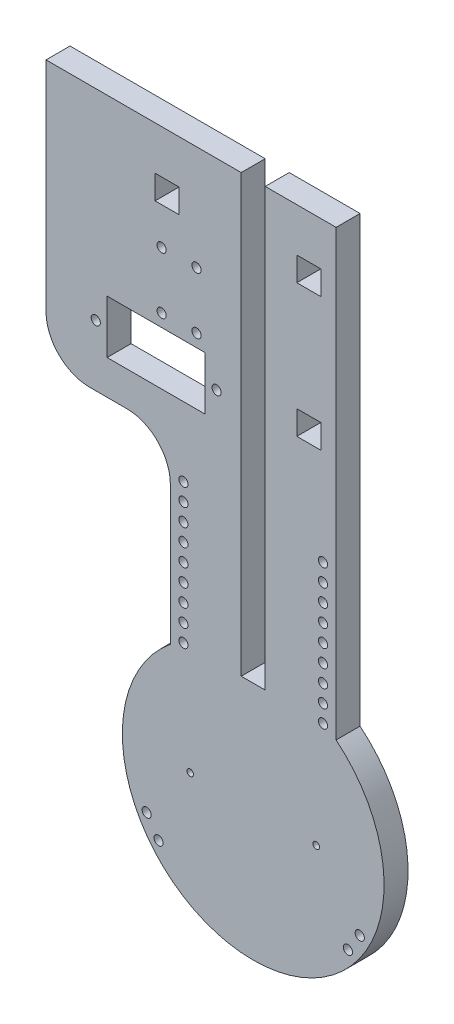
from build123d import *

# Parameters (mm, degrees)
EXTRUDE_1_DEPTH      = 5.5
SKETCH_5_R           = 0.75
CUT_EXTRUDE_3_DEPTH  = 134.83385222
SKETCH_6_R           = 1.05
CUT_EXTRUDE_4_DEPTH  = 134.83385222
SKETCH_8_W           = 5.5
SKETCH_8_H           = 5.5
CUT_EXTRUDE_6_DEPTH  = 134.83385222
SKETCH_9_R           = 1.05
CUT_EXTRUDE_7_DEPTH  = 134.83385222
SKETCH_10_W          = 5.5
SKETCH_10_H          = 100
CUT_EXTRUDE_8_DEPTH  = 134.83385222
SKETCH_11_R          = 1.05
CUT_EXTRUDE_9_DEPTH  = 134.83385222
SKETCH_12_R          = 1.05
SKETCH_12_W          = 22.5
SKETCH_12_H          = 12.2
CUT_EXTRUDE_10_DEPTH = 10
FILLET_1_R           = 10


with BuildPart() as part:
    # ｽｹｯﾁ1 → ﾎﾞｽ - 押し出し1 (new body)
    with BuildSketch(Plane.XY):
        with BuildLine():
            Line((19, 125), (-47.5, 125))
            Line((-47.5, 125), (-47.5, 65))
            Line((-47.5, 65), (-19, 65))
            Line((-19, 65), (-19, 23.216373532))
            ThreePointArc((-19, 23.216373532), (0, -30), (19, 23.216373532))
            Line((19, 23.216373532), (19, 125))
        make_face()
    extrude(amount=EXTRUDE_1_DEPTH)

    # ｽｹｯﾁ5 → ｶｯﾄ - 押し出し3 (cut, through all)
    with BuildSketch(Plane.XY.offset(5.5)):
        with Locations((14.45, 0)):
            Circle(SKETCH_5_R)
        with Locations((-14.45, 0)):
            Circle(SKETCH_5_R)
    extrude(amount=-CUT_EXTRUDE_3_DEPTH, mode=Mode.SUBTRACT)

    # ｽｹｯﾁ6 → ｶｯﾄ - 押し出し4 (cut, through all)
    with BuildSketch(Plane.XY.offset(5.5)):
        with Locations((-24.425038206, -12.880897043)):
            Circle(SKETCH_6_R)
        with Locations((-21.701843031, -17.074249883)):
            Circle(SKETCH_6_R)
        with Locations((24.425038206, -12.880897043)):
            Circle(SKETCH_6_R)
        with Locations((21.701843031, -17.074249883)):
            Circle(SKETCH_6_R)
    extrude(amount=-CUT_EXTRUDE_4_DEPTH, mode=Mode.SUBTRACT)

    # ｽｹｯﾁ8 → ｶｯﾄ - 押し出し6 (cut, through all)
    with BuildSketch(Plane.XY.offset(5.5)):
        with Locations((12.75, 112.25)):
            Rectangle(SKETCH_8_W, SKETCH_8_H)
        with Locations((-19.75, 112.25)):
            Rectangle(SKETCH_8_W, SKETCH_8_H)
        with Locations((12.75, 81.75)):
            Rectangle(SKETCH_8_W, SKETCH_8_H)
    extrude(amount=-CUT_EXTRUDE_6_DEPTH, mode=Mode.SUBTRACT)

    # ｽｹｯﾁ9 → ｶｯﾄ - 押し出し7 (cut, through all)
    with BuildSketch(Plane.XY.offset(5.5)):
        with Locations((16, 25)):
            Circle(SKETCH_9_R)
        with Locations((16, 29)):
            Circle(SKETCH_9_R)
        with Locations((16, 33)):
            Circle(SKETCH_9_R)
        with Locations((16, 37)):
            Circle(SKETCH_9_R)
        with Locations((16, 41)):
            Circle(SKETCH_9_R)
        with Locations((16, 45)):
            Circle(SKETCH_9_R)
        with Locations((16, 49)):
            Circle(SKETCH_9_R)
        with Locations((16, 53)):
            Circle(SKETCH_9_R)
        with Locations((16, 57)):
            Circle(SKETCH_9_R)
        with Locations((-16, 57)):
            Circle(SKETCH_9_R)
        with Locations((-16, 53)):
            Circle(SKETCH_9_R)
        with Locations((-16, 49)):
            Circle(SKETCH_9_R)
        with Locations((-16, 45)):
            Circle(SKETCH_9_R)
        with Locations((-16, 41)):
            Circle(SKETCH_9_R)
        with Locations((-16, 37)):
            Circle(SKETCH_9_R)
        with Locations((-16, 33)):
            Circle(SKETCH_9_R)
        with Locations((-16, 29)):
            Circle(SKETCH_9_R)
        with Locations((-16, 25)):
            Circle(SKETCH_9_R)
    extrude(amount=-CUT_EXTRUDE_7_DEPTH, mode=Mode.SUBTRACT)

    # ｽｹｯﾁ10 → ｶｯﾄ - 押し出し8 (cut, through all)
    with BuildSketch(Plane.XY.offset(5.5)):
        with Locations((0, 75)):
            Rectangle(SKETCH_10_W, SKETCH_10_H)
    extrude(amount=-CUT_EXTRUDE_8_DEPTH, mode=Mode.SUBTRACT)

    # ｽｹｯﾁ11 → ｶｯﾄ - 押し出し9 (cut, through all)
    with BuildSketch(Plane.XY.offset(5.5)):
        with Locations((-13, 101)):
            Circle(SKETCH_11_R)
        with Locations((-21, 101)):
            Circle(SKETCH_11_R)
        with Locations((-13, 88)):
            Circle(SKETCH_11_R)
        with Locations((-21, 88)):
            Circle(SKETCH_11_R)
    extrude(amount=-CUT_EXTRUDE_9_DEPTH, mode=Mode.SUBTRACT)

    # ｽｹｯﾁ12 → ｶｯﾄ - 押し出し10 (cut)
    with BuildSketch(Plane.XY.offset(5.5)):
        with Locations((-36.1, 79)):
            Circle(SKETCH_12_R)
        with Locations((-8.4, 79)):
            Circle(SKETCH_12_R)
        with Locations((-22.25, 79)):
            Rectangle(SKETCH_12_W, SKETCH_12_H)
    extrude(amount=-CUT_EXTRUDE_10_DEPTH, mode=Mode.SUBTRACT)

    # ﾌｨﾚｯﾄ1
    fillet_1_edges = [part.edges().sort_by_distance(p)[0] for p in [
        (-47.5, 65, 2.75),
        (-19, 65, 2.75),
    ]]
    fillet(fillet_1_edges, radius=FILLET_1_R)


solid = part.part
